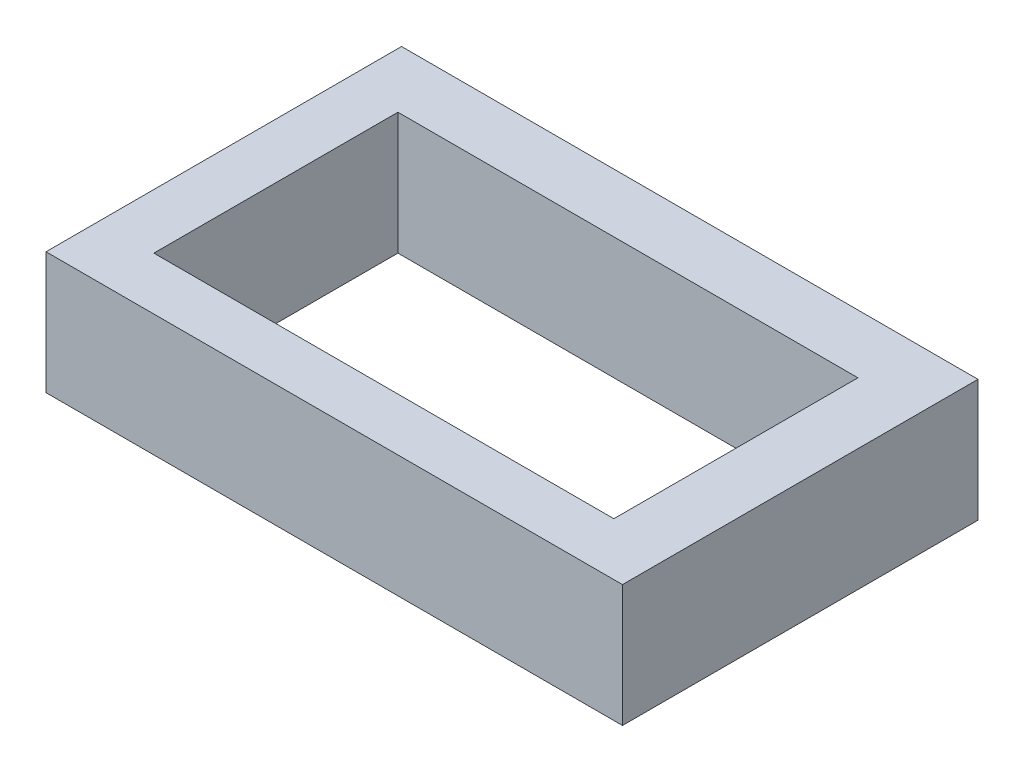
from build123d import *

# Parameters (mm, degrees)
SKETCH1_W           = 30.70266837
SKETCH1_H           = 18.936192253
SKETCH1_W_2         = 24.5
SKETCH1_H_2         = 13
BOSS_EXTRUDE1_DEPTH = 6.5


with BuildPart() as part:
    # Sketch1 → Boss-Extrude1 (new body)
    with BuildSketch(Plane(origin=(0, 0, 0), x_dir=(1, 0, 0), z_dir=(0, 1, 0))):
        with Locations((27.63237184, 21.627986596)):
            Rectangle(SKETCH1_W, SKETCH1_H)
        with Locations((27.466025805, 21.468777912)):
            Rectangle(SKETCH1_W_2, SKETCH1_H_2, mode=Mode.SUBTRACT)
    extrude(amount=BOSS_EXTRUDE1_DEPTH)


solid = part.part
